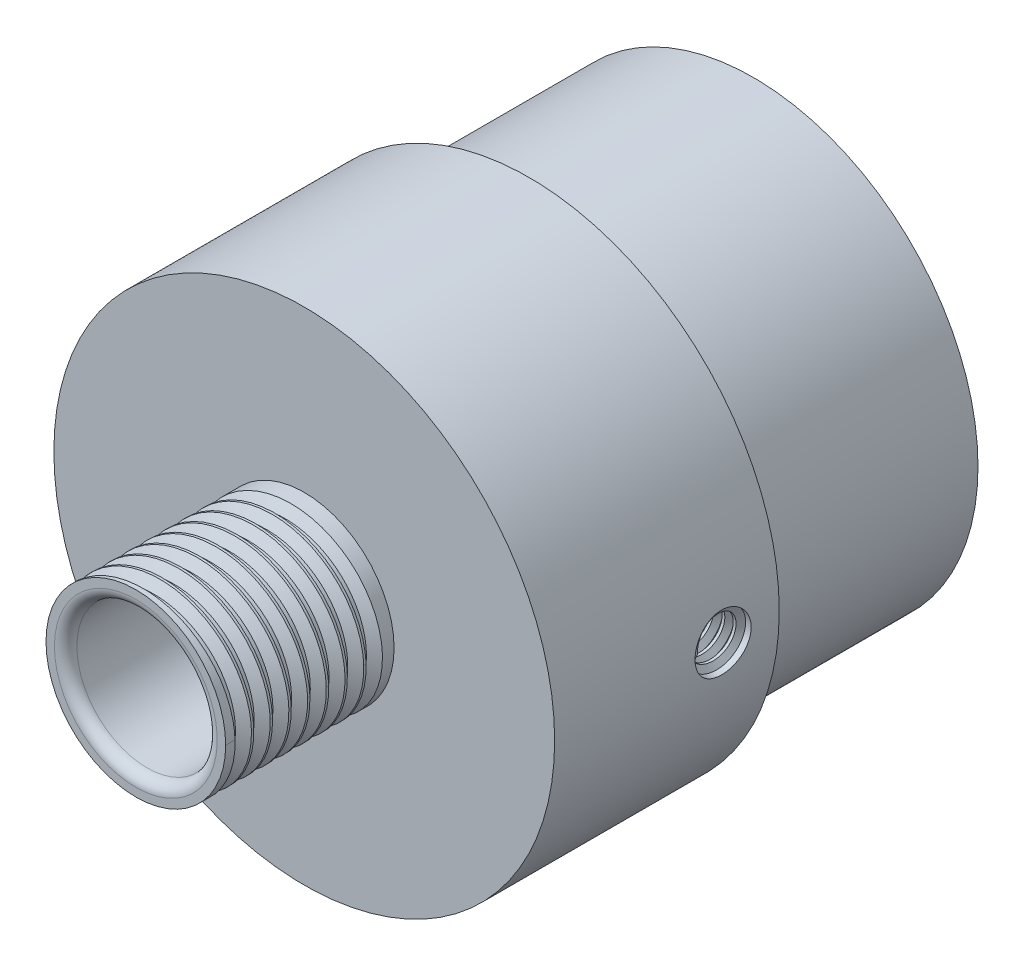
from build123d import *

# Parameters (mm, degrees)
FILLET1_R     = 1.27
THREAD1_PITCH = 2.116666667
THREAD2_PITCH = 1.27


with BuildPart() as part:
    # Sketch1 → Revolve1 (revolve)
    with BuildSketch(Plane(origin=(0, 0, 0), x_dir=(0, 0, -1), z_dir=(1, 0, 0)), mode=Mode.PRIVATE) as revolve1_sk:
        Polygon((-38.1, 7.9375), (-13.97, 7.9375), (-13.97, 10.16), (-7.62, 10.16), (-7.62, 7.9375), (26.67, 7.9375), (26.67, 17.78), (31.75, 17.78), (31.75, 20.32), (26.67, 20.32), (26.67, 22.86), (31.75, 22.86), (31.75, 25.4), (6.35, 25.4), (6.35, 28.321), (-19.05, 28.321), (-19.05, 10.16), (-38.1, 10.16), align=None)
    revolve(revolve1_sk.sketch.rotate(Axis((0, 0, 38.1), (0, 0, -1)), 90), axis=Axis((0, 0, 38.1), (0, 0, -1)))

    # Fillet1
    fillet1_edges = [part.edges().sort_by_distance(p)[0] for p in [
        (-7.9375, 0, 38.1),
    ]]
    fillet(fillet1_edges, radius=FILLET1_R)

    # Thread1: the profile of Thread Profile1 profile screwed along a right-hand helix of 7.8 turns, 10 arcs to a turn; built about Z, then put on its axis
    thread1_z = Axis((0, 0, 0), (0, 0, 1))
    thread1_corners = [(10.1603, 0, -0.000173205), (10.1603, 0, 1.852256533), (9.014320565, 0, 1.190624997), (9.014320565, 0, 0.66145833)]
    with BuildLine(mode=Mode.PRIVATE) as thread1_profile:
        Line(thread1_corners[0], thread1_corners[1])
        Line(thread1_corners[1], thread1_corners[2])
        Line(thread1_corners[2], thread1_corners[3])
        Line(thread1_corners[3], thread1_corners[0])
    thread1_cap = Face(thread1_profile.wire())
    thread1_turn_angles = [0, 18, 36, 54, 72, 90, 108, 126, 144, 162, 180, 198, 216, 234, 252, 270, 288, 306, 324, 342, 360]
    thread1_turn_weights = [1, 0.9510565162951535, 1, 0.9510565162951535, 1, 0.9510565162951535, 1, 0.9510565162951535, 1, 0.9510565162951535, 1, 0.9510565162951535, 1, 0.9510565162951535, 1, 0.9510565162951535, 1, 0.9510565162951535, 1, 0.9510565162951535, 1]
    thread1_turn_rails = [Edge.make_bspline([Vector(p[0], p[1], 0).rotate(thread1_z, thread1_turn_angles[k]) / thread1_turn_weights[k] + Vector(0, 0, p[2] + THREAD1_PITCH * thread1_turn_angles[k] / 360) for k in range(21)], [0, 0, 0, 1, 1, 2, 2, 3, 3, 4, 4, 5, 5, 6, 6, 7, 7, 8, 8, 9, 9, 10, 10, 10], 2, thread1_turn_weights) for p in thread1_corners]
    thread1_turn_sides = [Face.make_surface_from_curves(thread1_turn_rails[p[0]], thread1_turn_rails[p[1]]) for p in [(0, 1), (1, 2), (2, 3), (3, 0)]]
    thread1_last_angles = [2520, 2538, 2556, 2574, 2592, 2610, 2628, 2646, 2664, 2682, 2700, 2718, 2736, 2754, 2772, 2790, 2808]
    thread1_last_weights = [1, 0.9510565162951535, 1, 0.9510565162951535, 1, 0.9510565162951535, 1, 0.9510565162951535, 1, 0.9510565162951535, 1, 0.9510565162951535, 1, 0.9510565162951535, 1, 0.9510565162951511, 1]
    thread1_last_rails = [Edge.make_bspline([Vector(p[0], p[1], 0).rotate(thread1_z, thread1_last_angles[k]) / thread1_last_weights[k] + Vector(0, 0, p[2] + THREAD1_PITCH * thread1_last_angles[k] / 360) for k in range(17)], [0, 0, 0, 1, 1, 2, 2, 3, 3, 4, 4, 5, 5, 6, 6, 7, 7, 8, 8, 8], 2, thread1_last_weights) for p in thread1_corners]
    thread1_last_sides = [Face.make_surface_from_curves(thread1_last_rails[p[0]], thread1_last_rails[p[1]]) for p in [(0, 1), (1, 2), (2, 3), (3, 0)]]
    thread1 = Plane(origin=(0, 0, 38.1), x_dir=(-1, 0, 0), z_dir=(0, 0, -1)) * Solid(Shell([*[p.moved(Location((0, 0, THREAD1_PITCH * i))) for i in range(7) for p in thread1_turn_sides], *thread1_last_sides, thread1_cap, thread1_cap.rotate(thread1_z, 2808).moved(Location((0, 0, THREAD1_PITCH * 2808 / 360)))]))
    add(thread1, mode=Mode.SUBTRACT)

    # Sketch4 → #52 (0.25) Diameter Hole1 (revolve, cut)
    with BuildSketch(Plane(origin=(28.321, 0, 0), x_dir=(0, 0, -1), z_dir=(0, 1, 0))):
        Polygon((0, 0), (0, 27.307732465), (3.175, 25.4), (3.175, 0), align=None)
    revolve(axis=Axis((34.671, 0, 0), (-1, 0, 0)), mode=Mode.SUBTRACT)

    # Thread2: the profile of Thread Profile3 profile screwed along a right-hand helix of 16 turns, 8 arcs to a turn; built about Z, then put on its axis
    thread2_z = Axis((0, 0, 0), (0, 0, 1))
    thread2_corners = [(3.1753, 0, -0.000173205), (3.1753, 0, 1.111423202), (2.487592339, 0, 0.714374998), (2.487592339, 0, 0.396874998)]
    with BuildLine(mode=Mode.PRIVATE) as thread2_profile:
        Line(thread2_corners[0], thread2_corners[1])
        Line(thread2_corners[1], thread2_corners[2])
        Line(thread2_corners[2], thread2_corners[3])
        Line(thread2_corners[3], thread2_corners[0])
    thread2_cap = Face(thread2_profile.wire())
    thread2_turn_angles = [0, 22.5, 45, 67.5, 90, 112.5, 135, 157.5, 180, 202.5, 225, 247.5, 270, 292.5, 315, 337.5, 360]
    thread2_turn_weights = [1, 0.9238795325112867, 1, 0.9238795325112867, 1, 0.9238795325112867, 1, 0.9238795325112867, 1, 0.9238795325112867, 1, 0.9238795325112867, 1, 0.9238795325112867, 1, 0.9238795325112867, 1]
    thread2_turn_rails = [Edge.make_bspline([Vector(p[0], p[1], 0).rotate(thread2_z, thread2_turn_angles[k]) / thread2_turn_weights[k] + Vector(0, 0, p[2] + THREAD2_PITCH * thread2_turn_angles[k] / 360) for k in range(17)], [0, 0, 0, 1, 1, 2, 2, 3, 3, 4, 4, 5, 5, 6, 6, 7, 7, 8, 8, 8], 2, thread2_turn_weights) for p in thread2_corners]
    thread2_turn_sides = [Face.make_surface_from_curves(thread2_turn_rails[p[0]], thread2_turn_rails[p[1]]) for p in [(0, 1), (1, 2), (2, 3), (3, 0)]]
    thread2 = Plane(origin=(28.321, 0, 0), x_dir=(0, 0, 1), z_dir=(-1, 0, 0)) * Solid(Shell([*[p.moved(Location((0, 0, THREAD2_PITCH * i))) for i in range(16) for p in thread2_turn_sides], thread2_cap, thread2_cap.rotate(thread2_z, 5760).moved(Location((0, 0, THREAD2_PITCH * 5760 / 360)))]))
    add(thread2)


solid = part.part
